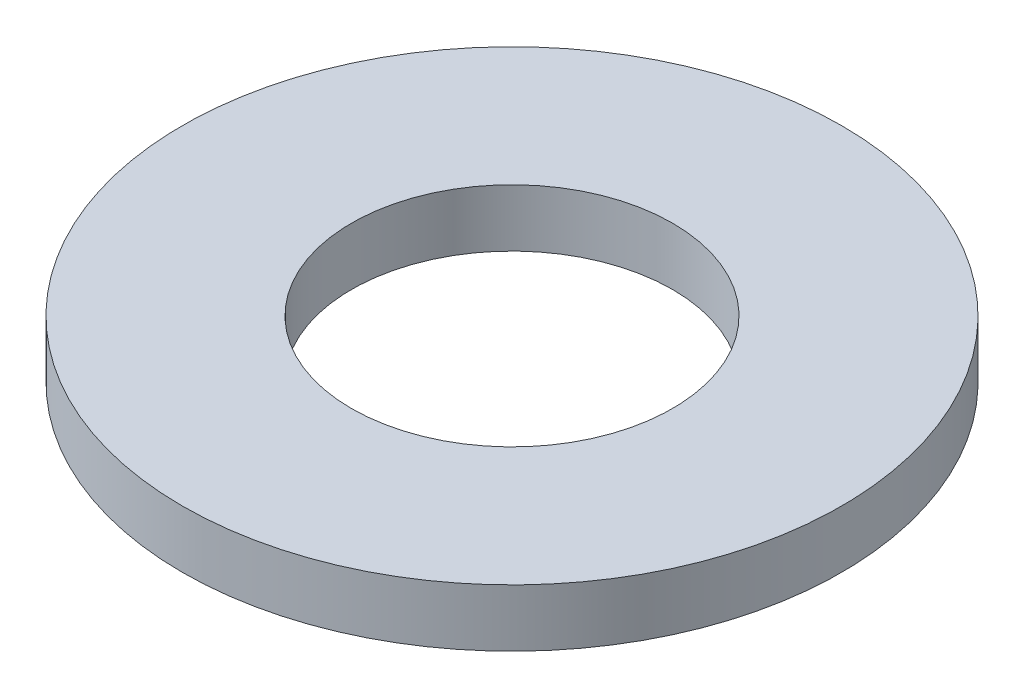
from build123d import *

# Parameters (mm, degrees)
SKETCH1_R           = 97.5
BOSS_EXTRUDE1_DEPTH = 17
SKETCH2_R           = 47.5
CUT_EXTRUDE1_DEPTH  = 139.929838408


with BuildPart() as part:
    # Sketch1 → Boss-Extrude1 (new body)
    with BuildSketch(Plane(origin=(0, 0, 0), x_dir=(1, 0, 0), z_dir=(0, 1, 0))):
        Circle(SKETCH1_R)
    extrude(amount=BOSS_EXTRUDE1_DEPTH)

    # Sketch2 → Cut-Extrude1 (cut, through all)
    with BuildSketch(Plane(origin=(0, 0, 0), x_dir=(1, 0, 0), z_dir=(0, 1, 0))):
        Circle(SKETCH2_R)
    extrude(amount=CUT_EXTRUDE1_DEPTH, mode=Mode.SUBTRACT)


solid = part.part
